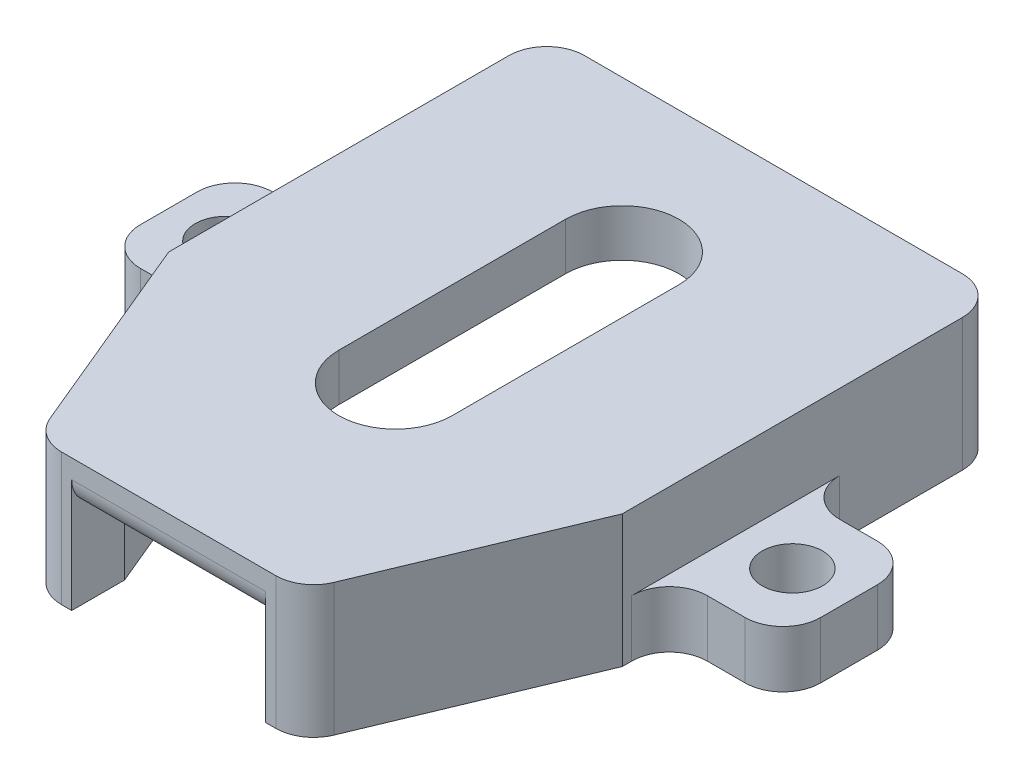
from build123d import *

# Parameters (mm, degrees)
EXTRUDE_1_DEPTH      = 3
SKETCH_7_R           = 1.75
SKETCH_7_R_2         = 2.25
CUT_EXTRUDE_2_DEPTH  = 143.955430949
CUT_EXTRUDE_4_DEPTH  = 3
CUT_EXTRUDE_5_DEPTH  = 3
CUT_EXTRUDE_8_DEPTH  = 3
SKETCH_12_R          = 1.7
CUT_EXTRUDE_9_DEPTH  = 3
SKETCH_13_R          = 1.7
CUT_EXTRUDE_11_DEPTH = 3
CUT_EXTRUDE_12_DEPTH = 143.955430949
FILLET_1_R           = 2
FILLET_2_R           = 2
CUT_EXTRUDE_13_DEPTH = 143.955430949
CUT_EXTRUDE_15_DEPTH = 143.955430949
CUT_EXTRUDE_16_DEPTH = 143.955430949
SKETCH_20_W          = 133.80338819
SKETCH_20_H          = 42.989432067
EXTRUDE_2_DEPTH      = 3
SKETCH_21_W          = 129.207272524
SKETCH_21_H          = 38.788932745
EXTRUDE_3_DEPTH      = 3
SKETCH_22_W          = 20.868569364
SKETCH_22_H          = 31.210515244
SKETCH_22_W_2        = 21.053246969
SKETCH_22_H_2        = 30.102449614
EXTRUDE_4_DEPTH      = 3
SKETCH_24_W          = 36.300662223
SKETCH_24_H          = 5.953308604
SKETCH_24_W_2        = 36.591067521
EXTRUDE_5_DEPTH      = 3
CUT_EXTRUDE_17_DEPTH = 143.955430949
CUT_EXTRUDE_19_DEPTH = 143.955430949
CUT_EXTRUDE_20_DEPTH = 143.955430949
CUT_EXTRUDE_21_DEPTH = 143.955430949
CUT_EXTRUDE_22_DEPTH = 143.955430949
CUT_EXTRUDE_23_DEPTH = 3
SKETCH_30_R          = 1.7
SKETCH_30_R_2        = 3.5
EXTRUDE_6_DEPTH      = 4
EXTRUDE_7_DEPTH      = 24
CUT_EXTRUDE_26_DEPTH = 31.5
EXTRUDE_8_DEPTH      = 10
EXTRUDE_9_DEPTH      = 1
CUT_EXTRUDE_27_DEPTH = 10
SKETCH_38_W          = 3
SKETCH_38_H          = 1
CUT_EXTRUDE_28_DEPTH = 166.273761152
CUT_EXTRUDE_29_DEPTH = 21
EXTRUDE_11_DEPTH     = 7
CUT_EXTRUDE_30_DEPTH = 5.5
EXTRUDE_12_DEPTH     = 3
CUT_EXTRUDE_31_DEPTH = 23
FILLET_4_R           = 0.7
FILLET_5_R           = 1
FILLET_6_R           = 1.2
CUT_EXTRUDE_32_DEPTH = 3
SKETCH_47_W          = 24
SKETCH_47_H          = 1
CUT_EXTRUDE_33_DEPTH = 167.672697425
SKETCH_48_W          = 6
SKETCH_48_H          = 7
SKETCH_48_R          = 1.6
EXTRUDE_13_DEPTH     = 3
FILLET_7_R           = 2
SKETCH_49_W          = 40.518885993
SKETCH_49_H          = 45.885701136
CUT_EXTRUDE_34_DEPTH = 33
FILLET_8_R           = 2
FILLET_9_R           = 2
FILLET_10_R          = 2
FILLET_11_R          = 2
FILLET_12_R          = 1.5
FILLET_13_R          = 1.5
SKETCH_51_W          = 46.608599542
SKETCH_51_H          = 55.034000229
CUT_EXTRUDE_36_DEPTH = 40


# Read off the part's stored shape, not the designer's step: 切除-拉伸35
with BuildPart() as part:
    # 草图1 → 凸台-拉伸1 (new body)
    # profile 1 of 14: a face of its own
    with BuildSketch(Plane.XY):
        with BuildLine():
            Line((60, 106.603296002), (35.889163634, 121.664519159))
            Line((35.889163634, 121.664519159), (-35.889163634, 121.664519159))
            Line((-35.889163634, 121.664519159), (-60, 106.603296002))
            Line((-60, 106.603296002), (-60, 94.801892265))
            Line((-60, 94.801892265), (-45, 94.801892265))
            ThreePointArc((-45, 94.801892265), (-43.762563133, 94.289329132), (-43.25, 93.051892265))
            Line((-43.25, 93.051892265), (-37.75, 93.051892265))
            ThreePointArc((-37.75, 93.051892265), (-37.237436867, 94.289329132), (-36, 94.801892265))
            Line((-36, 94.801892265), (-21, 94.801892265))
            ThreePointArc((-21, 94.801892265), (-19.762563133, 94.289329132), (-19.25, 93.051892265))
            Line((-19.25, 93.051892265), (19.25, 93.051892265))
            ThreePointArc((19.25, 93.051892265), (19.762563133, 94.289329132), (21, 94.801892265))
            Line((21, 94.801892265), (36, 94.801892265))
            ThreePointArc((36, 94.801892265), (37.237436867, 94.289329132), (37.75, 93.051892265))
            Line((37.75, 93.051892265), (43.25, 93.051892265))
            ThreePointArc((43.25, 93.051892265), (43.762563133, 94.289329132), (45, 94.801892265))
            Line((45, 94.801892265), (60, 94.801892265))
            Line((60, 94.801892265), (60, 106.603296002))
        make_face()
    # profile 2 of 14: a face of its own
    with BuildSketch(Plane.XY):
        with BuildLine():
            Line((66.901694095, 102.292041372), (60, 106.603296002))
            Line((60, 106.603296002), (60, 94.801892265))
            ThreePointArc((60, 94.801892265), (61.237436867, 94.289329132), (61.75, 93.051892265))
            Line((61.75, 93.051892265), (66.901694095, 93.051892265))
            Line((66.901694095, 93.051892265), (66.901694095, 102.292041372))
        make_face()
    # profile 3 of 14: a face of its own
    with BuildSketch(Plane.XY):
        with BuildLine():
            Line((-60, 94.801892265), (-60, 106.603296002))
            Line((-60, 106.603296002), (-66.901694095, 102.292041372))
            Line((-66.901694095, 102.292041372), (-66.901694095, 93.051892265))
            Line((-66.901694095, 93.051892265), (-61.75, 93.051892265))
            ThreePointArc((-61.75, 93.051892265), (-61.237436867, 94.289329132), (-60, 94.801892265))
        make_face()
    # profile 4 of 14: a face of its own
    with BuildSketch(Plane.XY):
        with BuildLine():
            Line((66.901694095, 63.051892265), (66.901694095, 93.051892265))
            Line((66.901694095, 93.051892265), (61.75, 93.051892265))
            ThreePointArc((61.75, 93.051892265), (61.237436867, 91.814455398), (60, 91.301892265))
            Line((60, 91.301892265), (60, 64.801892265))
            ThreePointArc((60, 64.801892265), (61.237436867, 64.289329132), (61.75, 63.051892265))
            Line((61.75, 63.051892265), (66.901694095, 63.051892265))
        make_face()
    # profile 5 of 14: a face of its own
    with BuildSketch(Plane.XY):
        with BuildLine():
            Line((-61.75, 93.051892265), (-66.901694095, 93.051892265))
            Line((-66.901694095, 93.051892265), (-66.901694095, 63.051892265))
            Line((-66.901694095, 63.051892265), (-61.75, 63.051892265))
            ThreePointArc((-61.75, 63.051892265), (-61.237436867, 64.289329132), (-60, 64.801892265))
            Line((-60, 64.801892265), (-60, 91.301892265))
            ThreePointArc((-60, 91.301892265), (-61.237436867, 91.814455398), (-61.75, 93.051892265))
        make_face()
    # profile 6 of 14: a face of its own
    with BuildSketch(Plane.XY):
        with BuildLine():
            Line((66.901694095, 52.870133869), (66.901694095, 63.051892265))
            Line((66.901694095, 63.051892265), (61.75, 63.051892265))
            ThreePointArc((61.75, 63.051892265), (61.237436867, 61.814455398), (60, 61.301892265))
            Line((60, 61.301892265), (60, 31.261343001))
            Line((60, 31.261343001), (75, 31.261343001))
            Line((75, 31.261343001), (75, 40.933889795))
            ThreePointArc((75, 40.933889795), (69.117351927, 45.658052319), (66.901694095, 52.870133869))
        make_face()
    # profile 7 of 14: a face of its own
    with BuildSketch(Plane.XY):
        with BuildLine():
            Line((60, 64.801892265), (60, 91.301892265))
            Line((60, 91.301892265), (45, 91.301892265))
            ThreePointArc((45, 91.301892265), (43.762563133, 91.814455398), (43.25, 93.051892265))
            Line((43.25, 93.051892265), (37.75, 93.051892265))
            ThreePointArc((37.75, 93.051892265), (37.237436867, 91.814455398), (36, 91.301892265))
            Line((36, 91.301892265), (21, 91.301892265))
            ThreePointArc((21, 91.301892265), (19.762563133, 91.814455398), (19.25, 93.051892265))
            Line((19.25, 93.051892265), (-19.25, 93.051892265))
            ThreePointArc((-19.25, 93.051892265), (-19.762563133, 91.814455398), (-21, 91.301892265))
            Line((-21, 91.301892265), (-36, 91.301892265))
            ThreePointArc((-36, 91.301892265), (-37.237436867, 91.814455398), (-37.75, 93.051892265))
            Line((-37.75, 93.051892265), (-43.25, 93.051892265))
            ThreePointArc((-43.25, 93.051892265), (-43.762563133, 91.814455398), (-45, 91.301892265))
            Line((-45, 91.301892265), (-60, 91.301892265))
            Line((-60, 91.301892265), (-60, 64.801892265))
            Line((-60, 64.801892265), (-45, 64.801892265))
            ThreePointArc((-45, 64.801892265), (-43.762563133, 64.289329132), (-43.25, 63.051892265))
            Line((-43.25, 63.051892265), (-37.75, 63.051892265))
            ThreePointArc((-37.75, 63.051892265), (-37.237436867, 64.289329132), (-36, 64.801892265))
            Line((-36, 64.801892265), (-21, 64.801892265))
            ThreePointArc((-21, 64.801892265), (-19.762563133, 64.289329132), (-19.25, 63.051892265))
            Line((-19.25, 63.051892265), (19.25, 63.051892265))
            ThreePointArc((19.25, 63.051892265), (19.762563133, 64.289329132), (21, 64.801892265))
            Line((21, 64.801892265), (36, 64.801892265))
            ThreePointArc((36, 64.801892265), (37.237436867, 64.289329132), (37.75, 63.051892265))
            Line((37.75, 63.051892265), (43.25, 63.051892265))
            ThreePointArc((43.25, 63.051892265), (43.762563133, 64.289329132), (45, 64.801892265))
            Line((45, 64.801892265), (60, 64.801892265))
        make_face()
    # profile 8 of 14: a face of its own
    with BuildSketch(Plane.XY):
        with BuildLine():
            Line((-61.75, 63.051892265), (-66.901694095, 63.051892265))
            Line((-66.901694095, 63.051892265), (-66.901694095, 52.870133869))
            ThreePointArc((-66.901694095, 52.870133869), (-69.117351927, 45.658052319), (-75, 40.933889795))
            Line((-75, 40.933889795), (-75, 31.261343001))
            Line((-75, 31.261343001), (-60, 31.261343001))
            Line((-60, 31.261343001), (-60, 61.301892265))
            ThreePointArc((-60, 61.301892265), (-61.237436867, 61.814455398), (-61.75, 63.051892265))
        make_face()
    # profile 9 of 14: a face of its own
    with BuildSketch(Plane.XY):
        with BuildLine():
            Line((60, 31.261343001), (60, 61.301892265))
            Line((60, 61.301892265), (45, 61.301892265))
            ThreePointArc((45, 61.301892265), (43.762563133, 61.814455398), (43.25, 63.051892265))
            Line((43.25, 63.051892265), (37.75, 63.051892265))
            ThreePointArc((37.75, 63.051892265), (37.237436867, 61.814455398), (36, 61.301892265))
            Line((36, 61.301892265), (21, 61.301892265))
            ThreePointArc((21, 61.301892265), (19.762563133, 61.814455398), (19.25, 63.051892265))
            Line((19.25, 63.051892265), (-19.25, 63.051892265))
            ThreePointArc((-19.25, 63.051892265), (-19.762563133, 61.814455398), (-21, 61.301892265))
            Line((-21, 61.301892265), (-36, 61.301892265))
            ThreePointArc((-36, 61.301892265), (-37.237436867, 61.814455398), (-37.75, 63.051892265))
            Line((-37.75, 63.051892265), (-43.25, 63.051892265))
            ThreePointArc((-43.25, 63.051892265), (-43.762563133, 61.814455398), (-45, 61.301892265))
            Line((-45, 61.301892265), (-60, 61.301892265))
            Line((-60, 61.301892265), (-60, 31.261343001))
            Line((-60, 31.261343001), (60, 31.261343001))
        make_face()
    # profile 10 of 14: a face of its own
    with BuildSketch(Plane.XY):
        with BuildLine():
            Line((60, -58.312864289), (60, 23.940028391))
            Line((60, 23.940028391), (-60, 23.940028391))
            Line((-60, 23.940028391), (-60, -58.312864289))
            Line((-60, -58.312864289), (-45, -58.312864289))
            ThreePointArc((-45, -58.312864289), (-43.25, -60.062864289), (-45, -61.812864289))
            Line((-45, -61.812864289), (-60, -61.812864289))
            Line((-60, -61.812864289), (-60, -88.312864289))
            Line((-60, -88.312864289), (-45, -88.312864289))
            ThreePointArc((-45, -88.312864289), (-43.25, -90.062864289), (-45, -91.812864289))
            Line((-45, -91.812864289), (-60, -91.812864289))
            Line((-60, -91.812864289), (-60, -111.849967256))
            Line((-60, -111.849967256), (-38.845469114, -105.590576733))
            ThreePointArc((-38.845469114, -105.590576733), (-36.037784492, -104.975210108), (-33.17088573, -104.768665882))
            Line((-33.17088573, -104.768665882), (33.17088573, -104.768665882))
            ThreePointArc((33.17088573, -104.768665882), (36.037784492, -104.975210108), (38.845469114, -105.590576733))
            Line((38.845469114, -105.590576733), (60, -111.849967256))
            Line((60, -111.849967256), (60, -91.812864289))
            Line((60, -91.812864289), (45, -91.812864289))
            ThreePointArc((45, -91.812864289), (43.762563133, -91.300301156), (43.25, -90.062864289))
            ThreePointArc((43.25, -90.062864289), (43.762563133, -88.825427422), (45, -88.312864289))
            Line((45, -88.312864289), (60, -88.312864289))
            Line((60, -88.312864289), (60, -61.812864289))
            Line((60, -61.812864289), (45, -61.812864289))
            ThreePointArc((45, -61.812864289), (43.762563133, -61.300301156), (43.25, -60.062864289))
            ThreePointArc((43.25, -60.062864289), (43.762563133, -58.825427422), (45, -58.312864289))
            Line((45, -58.312864289), (60, -58.312864289))
        make_face()
        with BuildLine():
            ThreePointArc((-21, -88.312864289), (-19.762563133, -88.825427422), (-19.25, -90.062864289))
            ThreePointArc((-19.25, -90.062864289), (-19.762563133, -91.300301156), (-21, -91.812864289))
            Line((-21, -91.812864289), (-36, -91.812864289))
            ThreePointArc((-36, -91.812864289), (-37.75, -90.062864289), (-36, -88.312864289))
            Line((-36, -88.312864289), (-21, -88.312864289))
        make_face(mode=Mode.SUBTRACT)
        with BuildLine():
            ThreePointArc((-21, -58.312864289), (-19.762563133, -58.825427422), (-19.25, -60.062864289))
            ThreePointArc((-19.25, -60.062864289), (-19.762563133, -61.300301156), (-21, -61.812864289))
            Line((-21, -61.812864289), (-36, -61.812864289))
            ThreePointArc((-36, -61.812864289), (-37.75, -60.062864289), (-36, -58.312864289))
            Line((-36, -58.312864289), (-21, -58.312864289))
        make_face(mode=Mode.SUBTRACT)
        with BuildLine():
            ThreePointArc((36, -88.312864289), (37.237436867, -88.825427422), (37.75, -90.062864289))
            ThreePointArc((37.75, -90.062864289), (37.237436867, -91.300301156), (36, -91.812864289))
            Line((36, -91.812864289), (21, -91.812864289))
            ThreePointArc((21, -91.812864289), (19.762563133, -91.300301156), (19.25, -90.062864289))
            ThreePointArc((19.25, -90.062864289), (19.762563133, -88.825427422), (21, -88.312864289))
            Line((21, -88.312864289), (36, -88.312864289))
        make_face(mode=Mode.SUBTRACT)
        with BuildLine():
            ThreePointArc((36, -58.312864289), (37.237436867, -58.825427422), (37.75, -60.062864289))
            ThreePointArc((37.75, -60.062864289), (37.237436867, -61.300301156), (36, -61.812864289))
            Line((36, -61.812864289), (21, -61.812864289))
            ThreePointArc((21, -61.812864289), (19.762563133, -61.300301156), (19.25, -60.062864289))
            ThreePointArc((19.25, -60.062864289), (19.762563133, -58.825427422), (21, -58.312864289))
            Line((21, -58.312864289), (36, -58.312864289))
        make_face(mode=Mode.SUBTRACT)
    # profile 11 of 14: a face of its own
    with BuildSketch(Plane.XY):
        with BuildLine():
            Line((75, 23.940028391), (60, 23.940028391))
            Line((60, 23.940028391), (60, -58.312864289))
            ThreePointArc((60, -58.312864289), (61.237436867, -58.825427422), (61.75, -60.062864289))
            Line((61.75, -60.062864289), (67.402721334, -60.062864289))
            add(Edge.make_bspline(
                [(75, 10.562559835), (72.695878257, 1.907314233), (70.339582535, -13.372796253), (67.818206704, -36.939032951), (67.208860388, -51.77269444), (67.402721334, -60.062864289)],
                knots=[0, 0, 0, 0, 0.235246678, 0.40629419, 0.624108181, 0.624108181, 0.624108181, 0.624108181], degree=3))
            Line((75, 10.562559835), (75, 23.940028391))
        make_face()
    # profile 12 of 14: a face of its own
    with BuildSketch(Plane.XY):
        with BuildLine():
            Line((-60, -58.312864289), (-60, 23.940028391))
            Line((-60, 23.940028391), (-75, 23.940028391))
            Line((-75, 23.940028391), (-75, 10.562559835))
            add(Edge.make_bspline(
                [(-75, 10.562559835), (-72.695878257, 1.907314233), (-70.339582535, -13.372796253), (-67.818206704, -36.939032951), (-67.208860388, -51.77269444), (-67.402721334, -60.062864289)],
                knots=[0, 0, 0, 0, 0.235246678, 0.40629419, 0.624108181, 0.624108181, 0.624108181, 0.624108181], degree=3))
            add(Edge.make_bspline(
                [(-67.402721334, -60.062864289), (-67.560325872, -66.802583754), (-68.323504015, -76.843670093), (-70.154131955, -86.778530076), (-70.533712858, -90.062864289)],
                knots=[0.624108181, 0.624108181, 0.624108181, 0.624108181, 0.801186001, 0.888408652, 0.888408652, 0.888408652, 0.888408652], degree=3))
            add(Edge.make_bspline(
                [(-70.533712858, -90.062864289), (-71.019342956, -94.264792095), (-71.137422935, -98.476048206), (-70.1742624, -102.732794059)],
                knots=[0.888408652, 0.888408652, 0.888408652, 0.888408652, 1, 1, 1, 1], degree=3))
            Line((-70.1742624, -102.732794059), (-66.460817635, -113.761651372))
            Line((-66.460817635, -113.761651372), (-60, -111.849967256))
            Line((-60, -111.849967256), (-60, -91.812864289))
            ThreePointArc((-60, -91.812864289), (-61.75, -90.062864289), (-60, -88.312864289))
            Line((-60, -88.312864289), (-60, -61.812864289))
            ThreePointArc((-60, -61.812864289), (-61.75, -60.062864289), (-60, -58.312864289))
        make_face()
    # profile 13 of 14: a face of its own
    with BuildSketch(Plane.XY):
        with BuildLine():
            Line((67.402721334, -60.062864289), (61.75, -60.062864289))
            ThreePointArc((61.75, -60.062864289), (61.237436867, -61.300301156), (60, -61.812864289))
            Line((60, -61.812864289), (60, -88.312864289))
            ThreePointArc((60, -88.312864289), (61.237436867, -88.825427422), (61.75, -90.062864289))
            Line((61.75, -90.062864289), (70.533712858, -90.062864289))
            add(Edge.make_bspline(
                [(67.402721334, -60.062864289), (67.560325872, -66.802583754), (68.323504015, -76.843670093), (70.154131955, -86.778530076), (70.533712858, -90.062864289)],
                knots=[0.624108181, 0.624108181, 0.624108181, 0.624108181, 0.801186001, 0.888408652, 0.888408652, 0.888408652, 0.888408652], degree=3))
        make_face()
    # profile 14 of 14: a face of its own
    with BuildSketch(Plane.XY):
        with BuildLine():
            add(Edge.make_bspline(
                [(70.533712858, -90.062864289), (71.019342956, -94.264792095), (71.137422935, -98.476048206), (70.1742624, -102.732794059)],
                knots=[0.888408652, 0.888408652, 0.888408652, 0.888408652, 1, 1, 1, 1], degree=3))
            Line((70.533712858, -90.062864289), (61.75, -90.062864289))
            ThreePointArc((61.75, -90.062864289), (61.237436867, -91.300301156), (60, -91.812864289))
            Line((60, -91.812864289), (60, -111.849967256))
            Line((60, -111.849967256), (66.460817635, -113.761651372))
            Line((66.460817635, -113.761651372), (70.1742624, -102.732794059))
        make_face()
    extrude(amount=EXTRUDE_1_DEPTH)

    # 草图7 → 切除-拉伸2 (cut, through all)
    with BuildSketch(Plane(origin=(0, 0, 0), x_dir=(-1, 0, 0), z_dir=(0, 0, -1))):
        with Locations((-21, 41.261343001)):
            Circle(SKETCH_7_R)
        with Locations((21, 41.261343001)):
            Circle(SKETCH_7_R)
        with Locations((-21, 13.940028391)):
            Circle(SKETCH_7_R_2)
        with Locations((21, 13.940028391)):
            Circle(SKETCH_7_R_2)
    extrude(amount=-CUT_EXTRUDE_2_DEPTH, mode=Mode.SUBTRACT)

    # 草图9 → 切除-拉伸4 (cut)
    with BuildSketch(Plane.XY.offset(3)):
        with BuildLine():
            Line((55, -100.49704609), (20, -100.49704609))
            ThreePointArc((20, -100.49704609), (18.25, -98.74704609), (20, -96.99704609))
            Line((20, -96.99704609), (55, -96.99704609))
            ThreePointArc((55, -96.99704609), (56.75, -98.74704609), (55, -100.49704609))
        make_face()
        with BuildLine():
            Line((-55, -96.99704609), (-20, -96.99704609))
            ThreePointArc((-20, -96.99704609), (-18.25, -98.74704609), (-20, -100.49704609))
            Line((-20, -100.49704609), (-55, -100.49704609))
            ThreePointArc((-55, -100.49704609), (-56.75, -98.74704609), (-55, -96.99704609))
        make_face()
    extrude(amount=-CUT_EXTRUDE_4_DEPTH, mode=Mode.SUBTRACT)

    # 草图10 → 切除-拉伸5 (cut)
    with BuildSketch(Plane.XY.offset(3)):
        with BuildLine():
            Line((12.5, -80.062864289), (-12.5, -80.062864289))
            ThreePointArc((-12.5, -80.062864289), (-17.5, -75.062864289), (-12.5, -70.062864289))
            Line((-12.5, -70.062864289), (12.5, -70.062864289))
            ThreePointArc((12.5, -70.062864289), (17.5, -75.062864289), (12.5, -80.062864289))
        make_face()
    extrude(amount=-CUT_EXTRUDE_5_DEPTH, mode=Mode.SUBTRACT)

    # 草图11 → 切除-拉伸8 (cut)
    with BuildSketch(Plane.XY.offset(3)):
        with BuildLine():
            Line((15, 73.051892265), (-15, 73.051892265))
            ThreePointArc((-15, 73.051892265), (-20, 78.051892265), (-15, 83.051892265))
            Line((-15, 83.051892265), (15, 83.051892265))
            ThreePointArc((15, 83.051892265), (20, 78.051892265), (15, 73.051892265))
        make_face()
    extrude(amount=-CUT_EXTRUDE_8_DEPTH, mode=Mode.SUBTRACT)

    # 草图12 → 切除-拉伸9 (cut)
    with BuildSketch(Plane.XY.offset(3)):
        with Locations((0, 114.371786435)):
            Circle(SKETCH_12_R)
        with Locations((0, 98.371786435)):
            Circle(SKETCH_12_R)
        with Locations((8, 106.371786435)):
            Circle(SKETCH_12_R)
        with Locations((-8, 106.371786435)):
            Circle(SKETCH_12_R)
    extrude(amount=-CUT_EXTRUDE_9_DEPTH, mode=Mode.SUBTRACT)

    # 草图13 → 切除-拉伸11 (cut)
    with BuildSketch(Plane.XY.offset(3)):
        with Locations((0, -84.415765086)):
            Circle(SKETCH_13_R)
        with Locations((8, -92.415765086)):
            Circle(SKETCH_13_R)
        with Locations((0, -100.415765086)):
            Circle(SKETCH_13_R)
        with Locations((-8, -92.415765086)):
            Circle(SKETCH_13_R)
    extrude(amount=-CUT_EXTRUDE_11_DEPTH, mode=Mode.SUBTRACT)

    # 草图14 → 切除-拉伸12 (cut, through all)
    with BuildSketch(Plane.XY.offset(3)):
        with BuildLine():
            Line((-55.475501567, 8.919687236), (-55.475501567, -46.080312764))
            ThreePointArc((-55.475501567, -46.080312764), (-57.225501567, -47.830312764), (-58.975501567, -46.080312764))
            Line((-58.975501567, -46.080312764), (-58.975501567, 8.919687236))
            ThreePointArc((-58.975501567, 8.919687236), (-57.225501567, 10.669687236), (-55.475501567, 8.919687236))
        make_face()
        with BuildLine():
            Line((58.975501567, 8.919687236), (58.975501567, -46.080312764))
            ThreePointArc((58.975501567, -46.080312764), (57.225501567, -47.830312764), (55.475501567, -46.080312764))
            Line((55.475501567, -46.080312764), (55.475501567, 8.919687236))
            ThreePointArc((55.475501567, 8.919687236), (57.225501567, 10.669687236), (58.975501567, 8.919687236))
        make_face()
    extrude(amount=-CUT_EXTRUDE_12_DEPTH, mode=Mode.SUBTRACT)

    # 圆角1
    fillet_1_edges = [part.edges().sort_by_distance(p)[0] for p in [
        (75, 31.261343001, 1.5),
        (-75, 31.261343001, 1.5),
    ]]
    fillet(fillet_1_edges, radius=FILLET_1_R)

    # 圆角2
    fillet_2_edges = [part.edges().sort_by_distance(p)[0] for p in [
        (-75, 23.940028391, 1.5),
        (75, 23.940028391, 1.5),
    ]]
    fillet(fillet_2_edges, radius=FILLET_2_R)

    # 草图15 → 切除-拉伸13 (cut, through all)
    with BuildSketch(Plane(origin=(0, 0, 0), x_dir=(-1, 0, 0), z_dir=(0, 0, -1))):
        with BuildLine():
            Line((-61.184216401, 102.403501276), (-34.774762862, 118.900592756))
            ThreePointArc((-34.774762862, 118.900592756), (-32.70788159, 118.423097411), (-33.185376934, 116.356216138))
            Line((-33.185376934, 116.356216138), (-59.594830473, 99.859124658))
            ThreePointArc((-59.594830473, 99.859124658), (-61.661711746, 100.336620003), (-61.184216401, 102.403501276))
        make_face()
        with BuildLine():
            Line((59.594830473, 99.859124658), (33.185376934, 116.356216138))
            ThreePointArc((33.185376934, 116.356216138), (32.70788159, 118.423097411), (34.774762862, 118.900592756))
            Line((34.774762862, 118.900592756), (61.184216401, 102.403501276))
            ThreePointArc((61.184216401, 102.403501276), (61.661711746, 100.336620003), (59.594830473, 99.859124658))
        make_face()
    extrude(amount=-CUT_EXTRUDE_13_DEPTH, mode=Mode.SUBTRACT)

    # 草图17 → 切除-拉伸15 (cut, through all)
    with BuildSketch(Plane(origin=(0, 0, 0), x_dir=(-1, 0, 0), z_dir=(0, 0, -1))):
        Polygon((-28.645414283, -8.118433382), (-34.644957411, -20.11751964), (-34.644957411, -29.946558382), (-37.580904049, -29.946558382), (-37.580904049, -20.11751964), (-43.580447177, -8.118433382), (-40.64450054, -8.118433382), (-36.176755657, -17.43687271), (-36.049105803, -17.43687271), (-31.58136092, -8.118433382), align=None)
    extrude(amount=-CUT_EXTRUDE_15_DEPTH, mode=Mode.SUBTRACT)

    # 草图18 → 切除-拉伸16 (cut, through all)
    with BuildSketch(Plane(origin=(0, 0, 0), x_dir=(-1, 0, 0), z_dir=(0, 0, -1))):
        Polygon((46.06697123, -29.087529791), (43.131024593, -29.087529791), (43.131024593, -18.875541487), (35.854982926, -18.875541487), (35.854982926, -29.087529791), (32.919036289, -29.087529791), (32.919036289, -7.259404791), (35.854982926, -7.259404791), (35.854982926, -16.450194265), (43.131024593, -16.450194265), (43.131024593, -7.259404791), (46.06697123, -7.259404791), align=None)
    extrude(amount=-CUT_EXTRUDE_16_DEPTH, mode=Mode.SUBTRACT)

    # 草图20 → 凸台-拉伸2 (add)
    with BuildSketch(Plane(origin=(0, 0, 0), x_dir=(-1, 0, 0), z_dir=(0, 0, -1))):
        with Locations((0, 74.364849902)):
            Rectangle(SKETCH_20_W, SKETCH_20_H)
    extrude(amount=-EXTRUDE_2_DEPTH)

    # 草图21 → 凸台-拉伸3 (add)
    with BuildSketch(Plane(origin=(0, 0, 0), x_dir=(-1, 0, 0), z_dir=(0, 0, -1))):
        with Locations((-0.162688936, -75.817262983)):
            Rectangle(SKETCH_21_W, SKETCH_21_H)
    extrude(amount=-EXTRUDE_3_DEPTH)

    # 草图22 → 凸台-拉伸4 (add)
    with BuildSketch(Plane(origin=(0, 0, 0), x_dir=(-1, 0, 0), z_dir=(0, 0, -1))):
        with Locations((-36.28455521, -18.718035035)):
            Rectangle(SKETCH_22_W, SKETCH_22_H)
        with Locations((39.340924035, -18.16400222)):
            Rectangle(SKETCH_22_W_2, SKETCH_22_H_2)
    extrude(amount=-EXTRUDE_4_DEPTH)

    # 草图24 → 凸台-拉伸5 (add)
    with BuildSketch(Plane(origin=(0, 0, 0), x_dir=(-1, 0, 0), z_dir=(0, 0, -1))):
        with Locations((-46.84572901, 41.350914957)):
            Rectangle(SKETCH_24_W, SKETCH_24_H)
        with Locations((47.53599277, 41.350914957)):
            Rectangle(SKETCH_24_W_2, SKETCH_24_H)
    extrude(amount=-EXTRUDE_5_DEPTH)

    # 草图25 → 切除-拉伸17 (cut, through all)
    with BuildSketch(Plane(origin=(0, 0, 0), x_dir=(-1, 0, 0), z_dir=(0, 0, -1))):
        with BuildLine():
            Line((-14.658238954, 113.011343001), (-32.658238954, 113.011343001))
            ThreePointArc((-32.658238954, 113.011343001), (-34.408238954, 111.261343001), (-32.658238954, 109.511343001))
            Line((-32.658238954, 109.511343001), (-14.658238954, 109.511343001))
            ThreePointArc((-14.658238954, 109.511343001), (-12.908238954, 111.261343001), (-14.658238954, 113.011343001))
        make_face()
        with BuildLine():
            Line((-20.999999982, 43.011343001), (-32.658238954, 43.011343001))
            ThreePointArc((-32.658238954, 43.011343001), (-34.408238954, 41.261343001), (-32.658238954, 39.511343001))
            Line((-32.658238954, 39.511343001), (-21, 39.511343001))
            ThreePointArc((-21, 39.511343001), (-22.75, 41.26134301), (-20.999999982, 43.011343001))
        make_face()
        with BuildLine():
            ThreePointArc((14.341761046, 113.011343001), (12.591761046, 111.261343001), (14.341761046, 109.511343001))
            Line((14.341761046, 109.511343001), (32.341761046, 109.511343001))
            ThreePointArc((32.341761046, 109.511343001), (34.091761046, 111.261343001), (32.341761046, 113.011343001))
            Line((32.341761046, 113.011343001), (14.341761046, 113.011343001))
        make_face()
        with BuildLine():
            Line((-14.658238954, 43.011343001), (-20.999999982, 43.011343001))
            ThreePointArc((-20.999999982, 43.011343001), (-19.25, 41.261342991), (-21, 39.511343001))
            Line((-21, 39.511343001), (-14.658238954, 39.511343001))
            ThreePointArc((-14.658238954, 39.511343001), (-12.908238954, 41.261343001), (-14.658238954, 43.011343001))
        make_face()
        with BuildLine():
            ThreePointArc((32.341761046, 39.511343001), (34.091761046, 41.261343001), (32.341761046, 43.011343001))
            Line((32.341761046, 43.011343001), (21, 43.011343001))
            ThreePointArc((21, 43.011343001), (22.75, 41.261343001), (21, 39.511343001))
            Line((21, 39.511343001), (32.341761046, 39.511343001))
        make_face()
        with BuildLine():
            ThreePointArc((14.341761046, 43.011343001), (12.591761046, 41.261343001), (14.341761046, 39.511343001))
            Line((14.341761046, 39.511343001), (21, 39.511343001))
            ThreePointArc((21, 39.511343001), (19.25, 41.261343001), (21, 43.011343001))
            Line((21, 43.011343001), (14.341761046, 43.011343001))
        make_face()
    extrude(amount=-CUT_EXTRUDE_17_DEPTH, mode=Mode.SUBTRACT)

    # 草图16 → 切除-拉伸19 (cut, through all)
    with BuildSketch(Plane(origin=(0, 0, 0), x_dir=(-1, 0, 0), z_dir=(0, 0, -1))):
        with BuildLine():
            Line((-62, 43.011343001), (-32, 43.011343001))
            ThreePointArc((-32, 43.011343001), (-30.25, 41.261343001), (-32, 39.511343001))
            Line((-32, 39.511343001), (-62, 39.511343001))
            ThreePointArc((-62, 39.511343001), (-63.75, 41.261343001), (-62, 43.011343001))
        make_face()
        with BuildLine():
            Line((62, 39.511343001), (32, 39.511343001))
            ThreePointArc((32, 39.511343001), (30.25, 41.261343001), (32, 43.011343001))
            Line((32, 43.011343001), (62, 43.011343001))
            ThreePointArc((62, 43.011343001), (63.75, 41.261343001), (62, 39.511343001))
        make_face()
    extrude(amount=-CUT_EXTRUDE_19_DEPTH, mode=Mode.SUBTRACT)

    # 草图26 → 切除-拉伸20 (cut, through all)
    with BuildSketch(Plane(origin=(0, 0, 0), x_dir=(-1, 0, 0), z_dir=(0, 0, -1))):
        with BuildLine():
            Line((15, 71.876956146), (-15, 71.876956146))
            ThreePointArc((-15, 71.876956146), (-20, 76.876956146), (-15, 81.876956146))
            Line((-15, 81.876956146), (15, 81.876956146))
            ThreePointArc((15, 81.876956146), (20, 76.876956146), (15, 71.876956146))
        make_face()
    extrude(amount=-CUT_EXTRUDE_20_DEPTH, mode=Mode.SUBTRACT)

    # 草图27 → 切除-拉伸21 (cut, through all)
    with BuildSketch(Plane(origin=(0, 0, 0), x_dir=(-1, 0, 0), z_dir=(0, 0, -1))):
        with BuildLine():
            Line((-10, -15.809971609), (-42.5, -15.809971609))
            ThreePointArc((-42.5, -15.809971609), (-44.25, -17.559971609), (-42.5, -19.309971609))
            Line((-42.5, -19.309971609), (-10, -19.309971609))
            ThreePointArc((-10, -19.309971609), (-8.25, -17.559971609), (-10, -15.809971609))
        make_face()
        with BuildLine():
            ThreePointArc((-42.5, 7.190028391), (-44.25, 5.440028391), (-42.5, 3.690028391))
            Line((-42.5, 3.690028391), (-10, 3.690028391))
            ThreePointArc((-10, 3.690028391), (-8.25, 5.440028391), (-10, 7.190028391))
            Line((-10, 7.190028391), (-42.5, 7.190028391))
        make_face()
        with BuildLine():
            Line((42.5, -15.809971609), (10, -15.809971609))
            ThreePointArc((10, -15.809971609), (8.25, -17.559971609), (10, -19.309971609))
            Line((10, -19.309971609), (42.5, -19.309971609))
            ThreePointArc((42.5, -19.309971609), (44.25, -17.559971609), (42.5, -15.809971609))
        make_face()
        with BuildLine():
            Line((42.5, 7.190028391), (10, 7.190028391))
            ThreePointArc((10, 7.190028391), (8.25, 5.440028391), (10, 3.690028391))
            Line((10, 3.690028391), (42.5, 3.690028391))
            ThreePointArc((42.5, 3.690028391), (44.25, 5.440028391), (42.5, 7.190028391))
        make_face()
    extrude(amount=-CUT_EXTRUDE_21_DEPTH, mode=Mode.SUBTRACT)

    # 草图28 → 切除-拉伸22 (cut, through all)
    with BuildSketch(Plane(origin=(0, 0, 0), x_dir=(-1, 0, 0), z_dir=(0, 0, -1))):
        with BuildLine():
            ThreePointArc((0, -48.812330529), (-7.86916468, -46.39674179), (-10.284753419, -54.26590647))
            ThreePointArc((-10.284753419, -54.26590647), (-5.977554294, -59.915955393), (0, -63.755729058))
            ThreePointArc((0, -63.755729058), (5.977554294, -59.915955393), (10.284753419, -54.26590647))
            ThreePointArc((10.284753419, -54.26590647), (7.86916468, -46.39674179), (0, -48.812330529))
        make_face()
    extrude(amount=-CUT_EXTRUDE_22_DEPTH, mode=Mode.SUBTRACT)

    # 草图29 → 切除-拉伸23 (cut)
    with BuildSketch(Plane(origin=(0, 0, 0), x_dir=(-1, 0, 0), z_dir=(0, 0, -1))):
        with BuildLine():
            ThreePointArc((-21.368709037, -73.490793052), (0, -84.713248851), (21.368709037, -73.490793052))
            ThreePointArc((21.368709037, -73.490793052), (23.760053677, -73.051240341), (24.199606389, -75.442584981))
            ThreePointArc((24.199606389, -75.442584981), (0, -88.151776376), (-24.199606389, -75.442584981))
            ThreePointArc((-24.199606389, -75.442584981), (-23.760053677, -73.051240341), (-21.368709037, -73.490793052))
        make_face()
    extrude(amount=-CUT_EXTRUDE_23_DEPTH, mode=Mode.SUBTRACT)


with BuildPart() as body_2:
    # 草图30 → 凸台-拉伸6 (new body)
    with BuildSketch(Plane(origin=(0, 0, -10), x_dir=(-1, 0, 0), z_dir=(0, 0, -1))):
        with BuildLine():
            Line((-12, 106.371786435), (-12, 141.664519159))
            Line((-12, 141.664519159), (12, 141.664519159))
            Line((12, 141.664519159), (12, 106.371786435))
            ThreePointArc((12, 106.371786435), (0, 94.371786435), (-12, 106.371786435))
        make_face()
        with Locations((8, 106.371786435)):
            Circle(SKETCH_30_R, mode=Mode.SUBTRACT)
        with Locations((0, 98.371786435)):
            Circle(SKETCH_30_R, mode=Mode.SUBTRACT)
        with Locations((-8, 106.371786435)):
            Circle(SKETCH_30_R, mode=Mode.SUBTRACT)
        with Locations((0, 114.371786435)):
            Circle(SKETCH_30_R, mode=Mode.SUBTRACT)
        with Locations((0, 106.371786435)):
            Circle(SKETCH_30_R_2, mode=Mode.SUBTRACT)
    extrude(amount=EXTRUDE_6_DEPTH)

    # 草图31 → 凸台-拉伸7 (add)
    with BuildSketch(Plane.ZY.offset(12)):
        Polygon((-10, 121.664519159), (15, 129.664519159), (18, 130.624519159), (18, 139.364328678), (15, 139.364328678), (15, 133.864328678), (-10, 125.864328678), align=None)
    extrude(amount=-EXTRUDE_7_DEPTH)

    # 草图32 → 切除-拉伸26 (cut)
    with BuildSketch(Plane.ZY.offset(12)):
        Polygon((-14, 124.584328678), (-10, 125.864328678), (-10, 141.664519159), (-14, 141.664519159), align=None)
    extrude(amount=-CUT_EXTRUDE_26_DEPTH, mode=Mode.SUBTRACT)

    # 草图34 → 凸台-拉伸8 (add)
    with BuildSketch(Plane(origin=(0, 139.364328678, 0), x_dir=(1, 0, 0), z_dir=(0, 1, 0))):
        Polygon((-12, -6), (-7, -18), (7, -18), (12, -6), (12, 14), (-12, 14), align=None)
    extrude(amount=EXTRUDE_8_DEPTH)

    # 草图36 → 凸台-拉伸9 (add)
    with BuildSketch(Plane(origin=(0, 137.364328678, 0), x_dir=(-1, 0, 0), z_dir=(0, -1, 0))):
        Polygon((-12, -6), (-8.25, -15), (8.25, -15), (12, -6), (12, 14), (-12, 14), align=None)
    extrude(amount=-EXTRUDE_9_DEPTH)

    # 草图37 → 切除-拉伸27 (cut)
    with BuildSketch(Plane(origin=(0, 149.364328678, 0), x_dir=(1, 0, 0), z_dir=(0, 1, 0))):
        Polygon((-12, 14), (-12, -6), (-7, -18), (7, -18), (12, -6), (12, 14), align=None)
    extrude(amount=-CUT_EXTRUDE_27_DEPTH, mode=Mode.SUBTRACT)

    # 草图38 → 切除-拉伸28 (cut, through all)
    with BuildSketch(Plane.ZY.offset(12)):
        with Locations((16.5, 138.864328678)):
            Rectangle(SKETCH_38_W, SKETCH_38_H)
    extrude(amount=-CUT_EXTRUDE_28_DEPTH, mode=Mode.SUBTRACT)

    # 草图39 → 切除-拉伸29 (cut)
    with BuildSketch(Plane(origin=(0, 138.364328678, 0), x_dir=(1, 0, 0), z_dir=(0, 1, 0))):
        Polygon((12, -6), (8.25, -15), (7, -18), (12, -18), align=None)
        Polygon((-8.25, -15), (-12, -6), (-12, -18), (-7, -18), align=None)
    extrude(amount=-CUT_EXTRUDE_29_DEPTH, mode=Mode.SUBTRACT)

    # 草图41 → 凸台-拉伸11 (add)
    with BuildSketch(Plane(origin=(0, 138.364328678, 0), x_dir=(1, 0, 0), z_dir=(0, 1, 0))):
        Polygon((-7, -18), (7, -18), (12, -6), (12, 14), (-12, 14), (-12, -6), align=None)
    extrude(amount=EXTRUDE_11_DEPTH)

    # 草图42 → 切除-拉伸30 (cut)
    with BuildSketch(Plane(origin=(0, 145.364328678, 0), x_dir=(1, 0, 0), z_dir=(0, 1, 0))):
        Polygon((-9.2, 14), (-9.2, 11.2), (-9.2, -5.44), (-5.133333333, -15.2), (-5.133333333, -18), (5.133333333, -18), (5.133333333, -15.2), (9.2, -5.44), (9.2, 11.2), (9.2, 14), align=None)
    extrude(amount=-CUT_EXTRUDE_30_DEPTH, mode=Mode.SUBTRACT)

    # 草图43 → 凸台-拉伸12 (add)
    with BuildSketch(Plane.ZY.offset(8.25)):
        Polygon((15, 137.364328678), (-14, 137.364328678), (-14, 124.584328678), (15, 133.864328678), align=None)
    extrude_12 = extrude(amount=-EXTRUDE_12_DEPTH)

    # 镜向1: 凸台-拉伸12 across plane
    add(extrude_12.mirror(Plane(origin=(0, 0, 0), x_dir=(0, 0, 1), z_dir=(1, 0, 0))))

    # 草图44 → 切除-拉伸31 (cut)
    with BuildSketch(Plane.ZY.offset(8.25)):
        Polygon((-11, 134.364328678), (6.719196439, 134.364328678), (-11, 128.694185818), align=None)
    extrude(amount=-CUT_EXTRUDE_31_DEPTH, mode=Mode.SUBTRACT)

    # 圆角4
    fillet_4_edges = [body_2.edges().sort_by_distance(p)[0] for p in [
        (-6.75, 134.364328678, 6.719196439),
        (6.75, 134.364328678, 6.719196439),
    ]]
    fillet(fillet_4_edges, radius=FILLET_4_R)

    # 圆角5
    fillet_5_edges = [body_2.edges().sort_by_distance(p)[0] for p in [
        (-6.75, 128.694185818, -11),
        (6.75, 128.694185818, -11),
    ]]
    fillet(fillet_5_edges, radius=FILLET_5_R)

    # 圆角6
    fillet_6_edges = [body_2.edges().sort_by_distance(p)[0] for p in [
        (-6.75, 134.364328678, -11),
        (6.75, 134.364328678, -11),
    ]]
    fillet(fillet_6_edges, radius=FILLET_6_R)

    # 草图45 → 切除-拉伸32 (cut)
    with BuildSketch(Plane(origin=(0, 139.864328678, 0), x_dir=(1, 0, 0), z_dir=(0, 1, 0))):
        with BuildLine():
            Line((3, -6), (3, 6))
            ThreePointArc((3, 6), (0, 9), (-3, 6))
            Line((-3, 6), (-3, -6))
            ThreePointArc((-3, -6), (0, -9), (3, -6))
        make_face()
    extrude(amount=-CUT_EXTRUDE_32_DEPTH, mode=Mode.SUBTRACT)

    # 草图47 → 切除-拉伸33 (cut, through all)
    with BuildSketch(Plane(origin=(0, 0, -14), x_dir=(-1, 0, 0), z_dir=(0, 0, -1))):
        with Locations((0, 144.864328678)):
            Rectangle(SKETCH_47_W, SKETCH_47_H)
    extrude(amount=-CUT_EXTRUDE_33_DEPTH, mode=Mode.SUBTRACT)

    # 草图48 → 凸台-拉伸13 (add)
    # profile 1 of 2: a face of its own
    with BuildSketch(Plane(origin=(0, 144.364328678, 0), x_dir=(1, 0, 0), z_dir=(0, 1, 0))):
        with Locations((-15, 0)):
            Rectangle(SKETCH_48_W, SKETCH_48_H)
        with Locations(Location((-15, 0, 0), (0, 0, 270))):
            Circle(SKETCH_48_R, mode=Mode.SUBTRACT)
    # profile 2 of 2: a face of its own
    with BuildSketch(Plane(origin=(0, 144.364328678, 0), x_dir=(1, 0, 0), z_dir=(0, 1, 0))):
        with Locations((15, 0)):
            Rectangle(SKETCH_48_W, SKETCH_48_H)
        with Locations(Location((15, 0, 0), (0, 0, 90))):
            Circle(SKETCH_48_R, mode=Mode.SUBTRACT)
    extrude(amount=-EXTRUDE_13_DEPTH)

    # 圆角7
    fillet_7_edges = [body_2.edges().sort_by_distance(p)[0] for p in [
        (-18, 142.864328678, 3.5),
        (-18, 142.864328678, -3.5),
        (-12, 142.864328678, -3.5),
        (-12, 142.864328678, 3.5),
        (18, 142.864328678, 3.5),
        (12, 142.864328678, 3.5),
        (12, 142.864328678, -3.5),
        (18, 142.864328678, -3.5),
    ]]
    fillet(fillet_7_edges, radius=FILLET_7_R)


with BuildPart() as body_3:
    # 镜向2: mirrored copy
    add(body_2.part.mirror(Plane.ZX.offset(148.364328678)))

    # 草图49 → 切除-拉伸34 (cut)
    with BuildSketch(Plane.ZY.offset(12)):
        with Locations((6.259442997, 182.307179246)):
            Rectangle(SKETCH_49_W, SKETCH_49_H)
    extrude(amount=-CUT_EXTRUDE_34_DEPTH, mode=Mode.SUBTRACT)

    # 圆角8
    fillet_8_edges = [body_3.edges().sort_by_distance(p)[0] for p in [
        (-12, 155.864328678, -14),
        (12, 155.864328678, -14),
        (7, 155.864328678, 18),
        (-7, 155.864328678, 18),
    ]]
    fillet(fillet_8_edges, radius=FILLET_8_R)

    # 圆角12
    fillet_12_edges = [body_3.edges().sort_by_distance(p)[0] for p in [
        (0, 156.864328678, 18),
    ]]
    fillet(fillet_12_edges, radius=FILLET_12_R)


with BuildPart() as body_2_1:
    add(body_2.part)

    # 圆角9
    fillet_9_edges = [body_2_1.edges().sort_by_distance(p)[0] for p in [
        (7, 137.494423918, 18),
        (-7, 137.494423918, 18),
    ]]
    fillet(fillet_9_edges, radius=FILLET_9_R)

    # 圆角10
    fillet_10_edges = [body_2_1.edges().sort_by_distance(p)[0] for p in [
        (-12, 140.864328678, -14),
        (12, 140.864328678, -14),
    ]]
    fillet(fillet_10_edges, radius=FILLET_10_R)

    # 圆角11
    fillet_11_edges = [body_2_1.edges().sort_by_distance(p)[0] for p in [
        (-10.125, 124.584328678, -14),
        (0, 124.584328678, -14),
        (10.125, 124.584328678, -14),
    ]]
    fillet(fillet_11_edges, radius=FILLET_11_R)

    # 圆角13
    fillet_13_edges = [body_2_1.edges().sort_by_distance(p)[0] for p in [
        (0, 139.864328678, 18),
    ]]
    fillet(fillet_13_edges, radius=FILLET_13_R)

    # 草图51 → 切除-拉伸36 (cut)
    with BuildSketch(Plane(origin=(0, 0, -14), x_dir=(-1, 0, 0), z_dir=(0, 0, -1))):
        with Locations((0.40334365, 119.025264365)):
            Rectangle(SKETCH_51_W, SKETCH_51_H)
    extrude(amount=-CUT_EXTRUDE_36_DEPTH, mode=Mode.SUBTRACT)


solid = body_3.part
